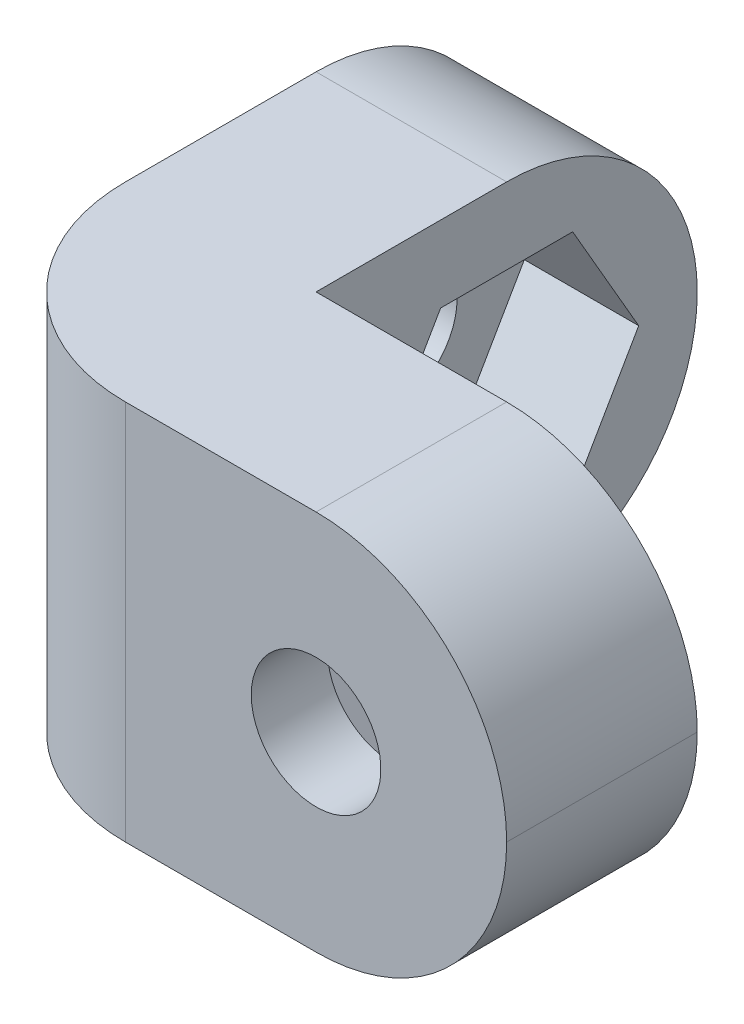
from build123d import *

# Parameters (mm, degrees)
BOSS_EXTRUDE1_DEPTH = 10
SKETCH2_R           = 1.7
CUT_EXTRUDE1_DEPTH  = 21.615528128
SKETCH3_R           = 1.7
CUT_EXTRUDE2_DEPTH  = 21.615528128
CUT_EXTRUDE3_DEPTH  = 3
CUT_EXTRUDE4_DEPTH  = 3
FILLET1_R           = 5


with BuildPart() as part:
    # Sketch1 → Boss-Extrude1 (new body)
    with BuildSketch(Plane(origin=(0, 0, 0), x_dir=(1, 0, 0), z_dir=(0, 1, 0))):
        Polygon((0, 0), (0, 15), (5, 15), (5, 5), (15, 5), (15, 0), align=None)
    extrude(amount=BOSS_EXTRUDE1_DEPTH)

    # Sketch2 → Cut-Extrude1 (cut, through all)
    with BuildSketch(Plane(origin=(0, 0, -5), x_dir=(-1, 0, 0), z_dir=(0, 0, -1))):
        with Locations((-10, 5)):
            Circle(SKETCH2_R)
    extrude(amount=-CUT_EXTRUDE1_DEPTH, mode=Mode.SUBTRACT)

    # Sketch3 → Cut-Extrude2 (cut, through all)
    with BuildSketch(Plane(origin=(5, 0, 0), x_dir=(0, 0, -1), z_dir=(1, 0, 0))):
        with Locations((10, 5)):
            Circle(SKETCH3_R)
    extrude(amount=-CUT_EXTRUDE2_DEPTH, mode=Mode.SUBTRACT)

    # Sketch4 → Cut-Extrude3 (cut)
    with BuildSketch(Plane(origin=(5, 0, 0), x_dir=(0, 0, -1), z_dir=(1, 0, 0))):
        Polygon((13.464101615, 5), (11.732050808, 8), (8.267949192, 8), (6.535898385, 5), (8.267949192, 2), (11.732050808, 2), align=None)
    extrude(amount=-CUT_EXTRUDE3_DEPTH, mode=Mode.SUBTRACT)

    # Sketch5 → Cut-Extrude4 (cut)
    with BuildSketch(Plane(origin=(0, 0, -5), x_dir=(-1, 0, 0), z_dir=(0, 0, -1))):
        Polygon((-6.535898385, 5), (-8.267949192, 8), (-11.732050808, 8), (-13.464101615, 5), (-11.732050808, 2), (-8.267949192, 2), align=None)
    extrude(amount=-CUT_EXTRUDE4_DEPTH, mode=Mode.SUBTRACT)

    # Fillet1
    fillet1_edges = [part.edges().sort_by_distance(p)[0] for p in [
        (0, 5, 0),
        (15, 10, -2.5),
        (15, 0, -2.5),
        (2.5, 0, -15),
        (2.5, 10, -15),
    ]]
    fillet(fillet1_edges, radius=FILLET1_R - 0.0001)  # a hair under: the kernel refuses the full size


solid = part.part
